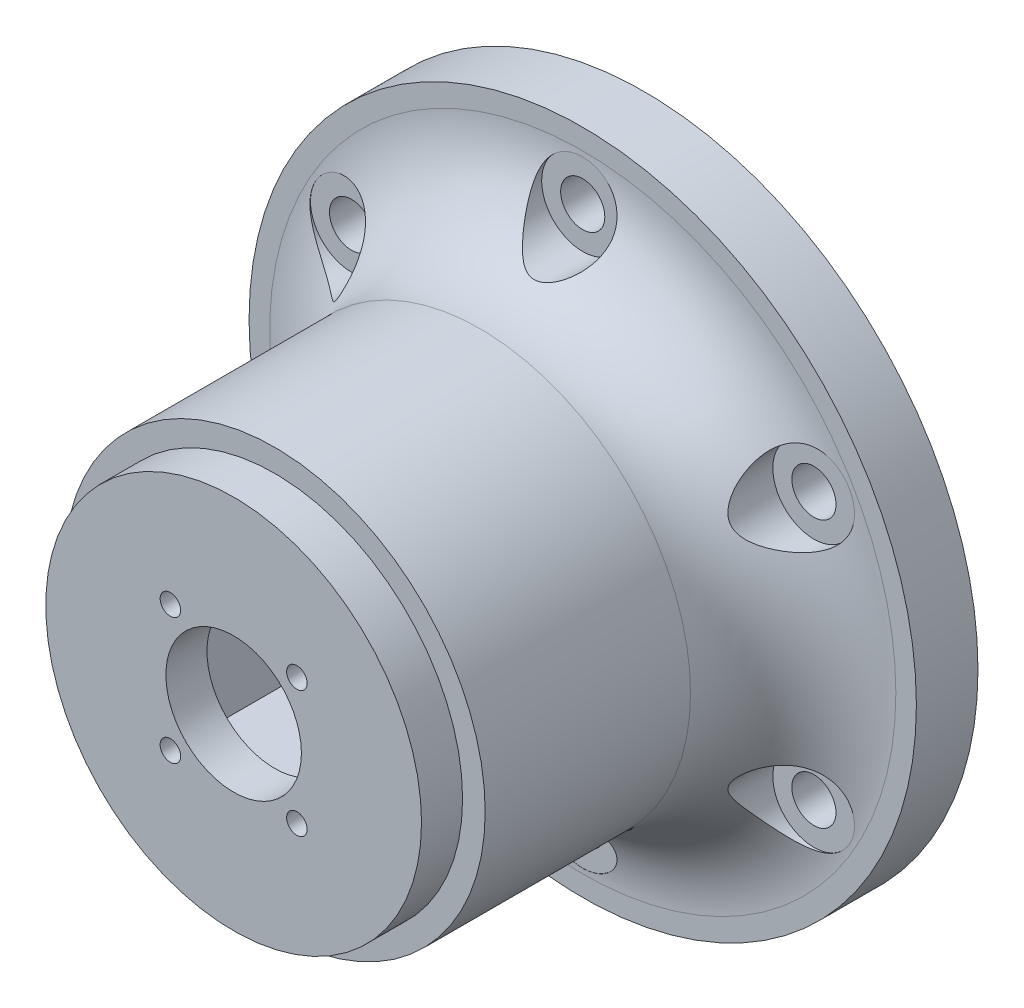
from build123d import *

# Parameters (mm, degrees)
SKETCH1_R           = 40.625
SKETCH1_R_2         = 2.6875
SKETCH1_W           = 25
SKETCH1_H           = 25
BOSS_EXTRUDE1_DEPTH = 7.5
SKETCH1_3_R         = 25.625
SKETCH1_3_W         = 25
SKETCH1_3_H         = 25
BOSS_EXTRUDE2_DEPTH = 42.5
FILLET2_2_OUTLINE_R = 2.6875
FILLET2_2_DEPTH     = 3.164444439
SKETCH1_4_R         = 5
CUT_EXTRUDE1_DEPTH  = 72.463495926
BOSS_EXTRUDE3_START = 42.5
SKETCH1_5_W         = 25
SKETCH1_5_H         = 25
SKETCH1_5_R         = 1.25
SKETCH1_5_R_2       = 8.25
BOSS_EXTRUDE3_DEPTH = 5
CUT_EXTRUDE2_START  = 37.5
SKETCH1_6_R         = 25.625
SKETCH1_6_R_2       = 22.875
CUT_EXTRUDE2_DEPTH  = 5


with BuildPart() as part:
    # Sketch1 → Boss-Extrude1 (new body)
    with BuildSketch(Plane.XY):
        Circle(SKETCH1_R)
        with Locations((0, 32.5)):
            Circle(SKETCH1_R_2, mode=Mode.SUBTRACT)
        with Locations((28.145825623, 16.25)):
            Circle(SKETCH1_R_2, mode=Mode.SUBTRACT)
        with Locations((28.145825623, -16.25)):
            Circle(SKETCH1_R_2, mode=Mode.SUBTRACT)
        with Locations((0, -32.5)):
            Circle(SKETCH1_R_2, mode=Mode.SUBTRACT)
        with Locations((-28.145825623, -16.25)):
            Circle(SKETCH1_R_2, mode=Mode.SUBTRACT)
        with Locations((-28.145825623, 16.25)):
            Circle(SKETCH1_R_2, mode=Mode.SUBTRACT)
        Rectangle(SKETCH1_W, SKETCH1_H, mode=Mode.SUBTRACT)
    extrude(amount=-BOSS_EXTRUDE1_DEPTH)

    # Sketch1<3> → Boss-Extrude2 (add)
    with BuildSketch(Plane.XY):
        Circle(SKETCH1_3_R)
        Rectangle(SKETCH1_3_W, SKETCH1_3_H, mode=Mode.SUBTRACT)
    extrude(amount=BOSS_EXTRUDE2_DEPTH)

    # Fillet2: read off the stored shape, not the designer's step
    # Fillet2 outline → Fillet2 (revolve)
    with BuildSketch(Plane.XZ):
        with BuildLine():
            ThreePointArc((38.125, 0), (29.286165235, 3.661165235), (25.625, 12.5))
            Line((25.625, 12.5), (25.625, 0))
            Line((25.625, 0), (38.125, 0))
        make_face()
    revolve(axis=Axis((0, 0, 0), (0, 0, 1)))

    # Fillet2 2 outline → Fillet2 2 (cut)
    with BuildSketch(Plane.XY):
        with Locations((0, 32.5)):
            Circle(FILLET2_2_OUTLINE_R)
        with Locations((-28.145825623, 16.25)):
            Circle(FILLET2_2_OUTLINE_R)
        with Locations((28.145825623, 16.25)):
            Circle(FILLET2_2_OUTLINE_R)
        with Locations((-28.145825623, -16.25)):
            Circle(FILLET2_2_OUTLINE_R)
        with Locations((0, -32.5)):
            Circle(FILLET2_2_OUTLINE_R)
        with Locations((28.145825623, -16.25)):
            Circle(FILLET2_2_OUTLINE_R)
    extrude(amount=FILLET2_2_DEPTH, mode=Mode.SUBTRACT)

    # Sketch1<4> → Cut-Extrude1 (cut, through all)
    with BuildSketch(Plane.XY):
        with Locations(Location((0, 32.5, 0), (0, 0, 223.199248812))):
            Circle(SKETCH1_4_R)
        with Locations(Location((28.145825623, 16.25, 0), (0, 0, 235.304779613))):
            Circle(SKETCH1_4_R)
        with Locations(Location((-28.145825623, 16.25, 0), (0, 0, 228.510303159))):
            Circle(SKETCH1_4_R)
        with Locations(Location((-28.145825623, -16.25, 0), (0, 0, 213.795366165))):
            Circle(SKETCH1_4_R)
        with Locations(Location((0, -32.5, 0), (0, 0, 234.908607799))):
            Circle(SKETCH1_4_R)
        with Locations(Location((28.145825623, -16.25, 0), (0, 0, 226.366250756))):
            Circle(SKETCH1_4_R)
    extrude(amount=CUT_EXTRUDE1_DEPTH, mode=Mode.SUBTRACT)

    # Sketch1<5> → Boss-Extrude3 (add)
    with BuildSketch(Plane.XY.offset(BOSS_EXTRUDE3_START)):
        Rectangle(SKETCH1_5_W, SKETCH1_5_H)
        with Locations((-7.7, -7.7)):
            Circle(SKETCH1_5_R, mode=Mode.SUBTRACT)
        with Locations((7.7, -7.7)):
            Circle(SKETCH1_5_R, mode=Mode.SUBTRACT)
        with Locations((7.7, 7.7)):
            Circle(SKETCH1_5_R, mode=Mode.SUBTRACT)
        with Locations((-7.7, 7.7)):
            Circle(SKETCH1_5_R, mode=Mode.SUBTRACT)
        Circle(SKETCH1_5_R_2, mode=Mode.SUBTRACT)
    extrude(amount=-BOSS_EXTRUDE3_DEPTH)

    # Sketch1<6> → Cut-Extrude2 (cut)
    with BuildSketch(Plane.XY.offset(CUT_EXTRUDE2_START)):
        Circle(SKETCH1_6_R)
        Circle(SKETCH1_6_R_2, mode=Mode.SUBTRACT)
    extrude(amount=CUT_EXTRUDE2_DEPTH, mode=Mode.SUBTRACT)


solid = part.part
